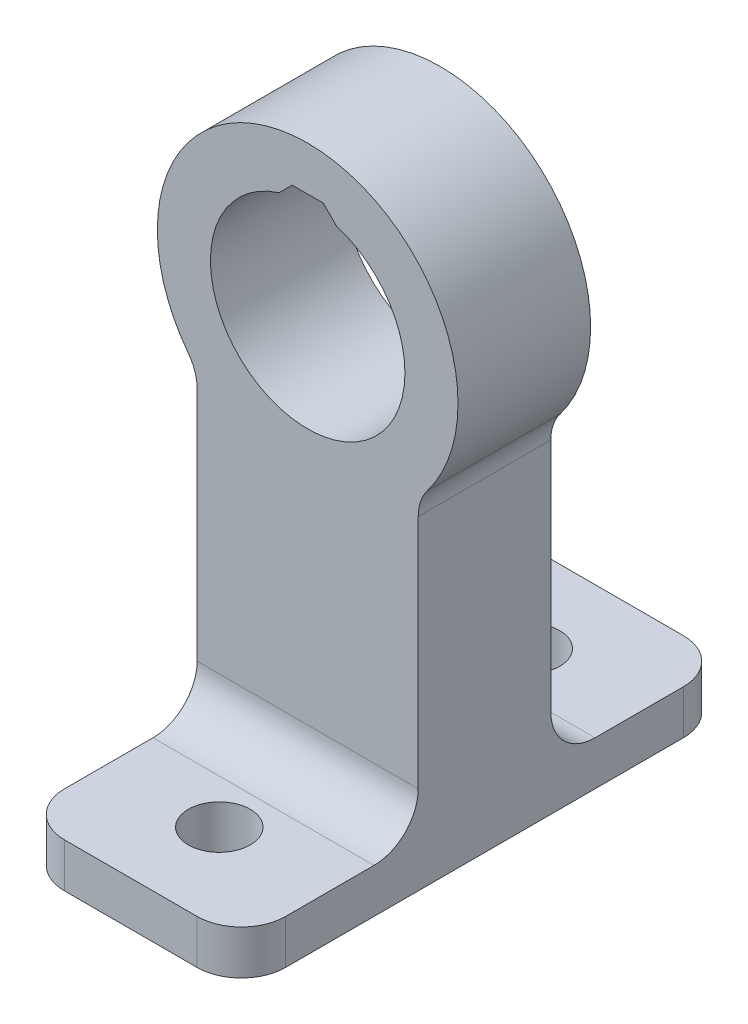
from build123d import *

# Parameters (mm, degrees)
BOSS_EXTRUDE1_DEPTH = 15
SKETCH6_W           = 25
SKETCH6_H           = 20
SKETCH6_R           = 3.5
BOSS_EXTRUDE4_DEPTH = 5
FILLET4_R           = 5


with BuildPart() as part:
    # Sketch1 → Boss-Extrude1 (new body)
    with BuildSketch(Plane.XY):
        with BuildLine():
            Line((-12.5, -11.521718622), (-12.5, -50))
            Line((-12.5, -50), (12.5, -50))
            Line((12.5, -50), (12.5, -11.521718622))
            ThreePointArc((12.5, -11.521718622), (0, 17), (-12.5, -11.521718622))
        make_face()
        with BuildLine():
            Line((-3.25, 10.508924778), (-1.758924778, 12))
            Line((-1.758924778, 12), (1.758924778, 12))
            Line((1.758924778, 12), (3.25, 10.508924778))
            ThreePointArc((3.25, 10.508924778), (0, -11), (-3.25, 10.508924778))
        make_face(mode=Mode.SUBTRACT)
    extrude(amount=BOSS_EXTRUDE1_DEPTH)

    # Sketch6 → Boss-Extrude4 (add)
    # profile 1 of 2: a face of its own
    with BuildSketch(Plane.XZ.offset(50)):
        with Locations((0, 25)):
            Rectangle(SKETCH6_W, SKETCH6_H)
        with Locations((0, 25)):
            Circle(SKETCH6_R, mode=Mode.SUBTRACT)
    # profile 2 of 2: a face of its own
    with BuildSketch(Plane.XZ.offset(50)):
        with Locations((0, -10)):
            Rectangle(SKETCH6_W, SKETCH6_H)
        with Locations((0, -10)):
            Circle(SKETCH6_R, mode=Mode.SUBTRACT)
    extrude(amount=-BOSS_EXTRUDE4_DEPTH)

    # Fillet4
    fillet4_edges = [part.edges().sort_by_distance(p)[0] for p in [
        (-12.5, -47.5, -20),
        (12.5, -47.5, -20),
        (-12.5, -47.5, 35),
        (12.5, -47.5, 35),
        (0, -45, 15),
        (0, -45, 0),
        (12.5, -11.521718622, 7.5),
        (-12.5, -11.521718622, 7.5),
    ]]
    fillet(fillet4_edges, radius=FILLET4_R)


solid = part.part
